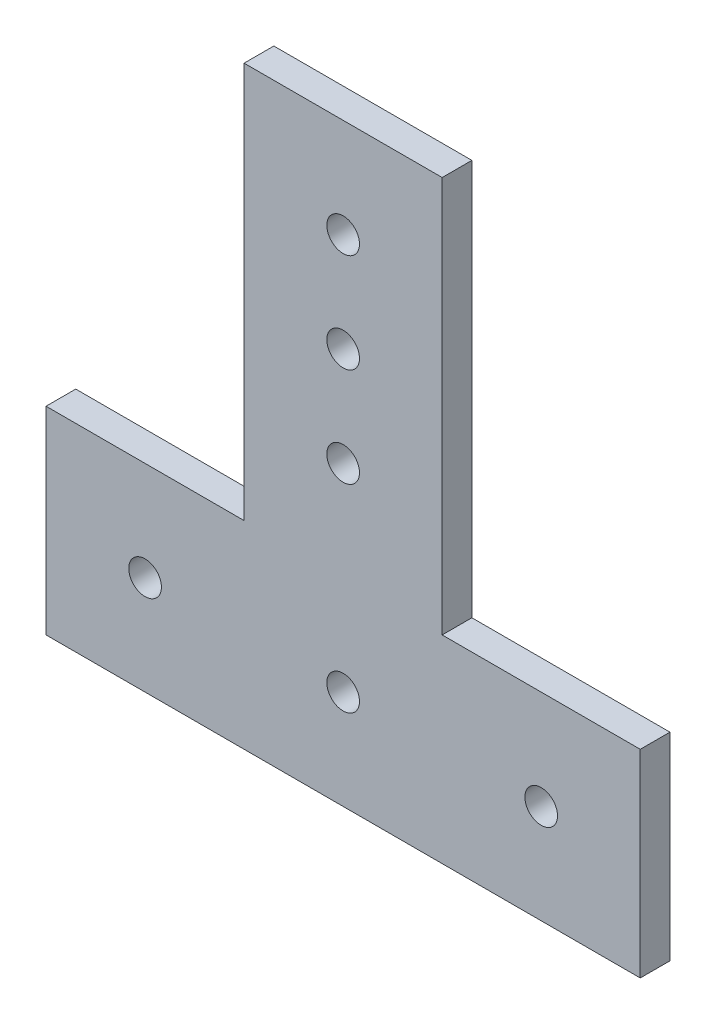
from build123d import *

# Parameters (mm, degrees)
SKETCH_1_R      = 1.65
EXTRUDE_1_DEPTH = 3


with BuildPart() as part:
    # 草图1 → 凸台-拉伸1 (new body)
    with BuildSketch(Plane.XY):
        Polygon((10, 10), (30, 10), (30, -10), (-30, -10), (-30, 10), (-10, 10), (-10, 50), (10, 50), align=None)
        Circle(SKETCH_1_R, mode=Mode.SUBTRACT)
        with Locations((-20, 0)):
            Circle(SKETCH_1_R, mode=Mode.SUBTRACT)
        with Locations((20, 0)):
            Circle(SKETCH_1_R, mode=Mode.SUBTRACT)
        with Locations((0, 20)):
            Circle(SKETCH_1_R, mode=Mode.SUBTRACT)
        with Locations((0, 30)):
            Circle(SKETCH_1_R, mode=Mode.SUBTRACT)
        with Locations((0, 40)):
            Circle(SKETCH_1_R, mode=Mode.SUBTRACT)
    extrude(amount=EXTRUDE_1_DEPTH)


solid = part.part
